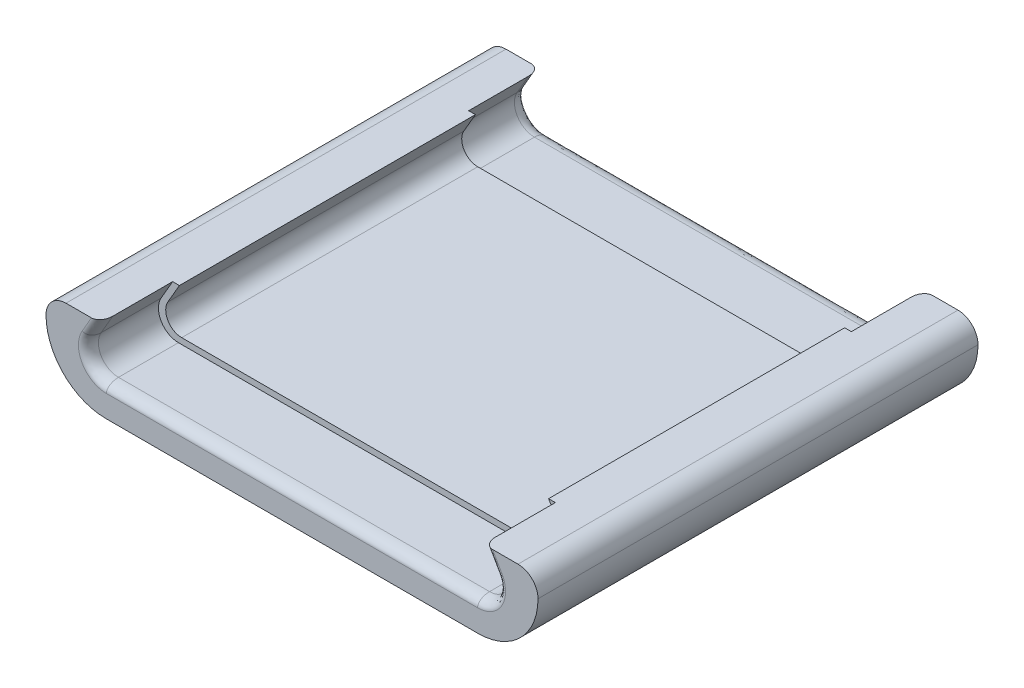
from build123d import *
from build123d.topology import SkipClean

# Parameters (mm, degrees)
SKETCH1_W           = 123
SKETCH1_H           = 110
BOSS_EXTRUDE1_DEPTH = 20
CUT_EXTRUDE3_DEPTH  = 150
FILLET2_R           = 5
FILLET5_R           = 15
FILLET6_SIZE        = 2
FILLET6_SIZE_2      = 3
FILLET7_SIZE        = 2
FILLET7_SIZE_2      = 3
FILLET8_R           = 5
BOSS_EXTRUDE3_START = -18
SKETCH6_W           = 113
SKETCH6_H           = 14.5
BOSS_EXTRUDE3_DEPTH = 64
CUT_EXTRUDE4_DEPTH  = 64
FILLET10_R          = 4
BOSS_EXTRUDE4_DEPTH = 10


# Some blends are built 0.0001 mm under size
with BuildPart() as part:
    # Sketch1 → Boss-Extrude1 (new body)
    with BuildSketch(Plane(origin=(0, 0, 0), x_dir=(1, 0, 0), z_dir=(0, 1, 0))):
        with Locations((53.726554268, 129.299262381)):
            Rectangle(SKETCH1_W, SKETCH1_H)
    extrude(amount=BOSS_EXTRUDE1_DEPTH)

    # Sketch5 → Cut-Extrude3 (cut)
    with BuildSketch(Plane.XY.offset(-74.299262381)):
        Polygon((5.893432633, 20), (101.559675903, 20), (108.776554268, 7.5), (-1.323445732, 7.5), align=None)
    extrude(amount=-CUT_EXTRUDE3_DEPTH, mode=Mode.SUBTRACT)

    # Fillet2
    fillet2_edges = [part.edges().sort_by_distance(p)[0] for p in [
        (108.776554268, 7.5, -129.299262381),
        (-1.323445732, 7.5, -129.299262381),
    ]]
    fillet(fillet2_edges, radius=FILLET2_R)

    # Fillet5
    fillet5_edges = [part.edges().sort_by_distance(p)[0] for p in [
        (115.226554268, 0, -129.299262381),
        (-7.773445732, 0, -129.299262381),
    ]]
    fillet(fillet5_edges, radius=FILLET5_R)

    # Fillet6
    # an asymmetric fillet: 3, 2 mm, written as the material it takes off along each edge
    with BuildSketch(Plane(origin=(3.006681287, 15, -74.299262381), x_dir=(-0.8660254037844386, 0.5000000000000001, 0), z_dir=(0.5000000000000001, 0.8660254037844387, 0)), Plane(origin=(97.809675903, 26.495190529, -74.299262381), x_dir=(0.8660254037844344, 0.5000000000000074, 0), z_dir=(0.5000000000000074, -0.8660254037844345, 0))) as fillet6_piece_1:
        with BuildLine():
            Bezier((FILLET6_SIZE, 0), (0, 0), (0, -FILLET6_SIZE_2), weights=[1, 0.707106781, 1])
            Line((0, -FILLET6_SIZE_2), (0, 0))
            Line((0, 0), (FILLET6_SIZE, 0))
        make_face()
    extrude(amount=13.273502692, mode=Mode.SUBTRACT)
    with BuildSketch(Plane(origin=(7.336808305, 12.5, -74.299262381), x_dir=(0, -1, 0), z_dir=(1, 0, 0))) as fillet6_piece_2:
        with BuildLine():
            Bezier((5 + FILLET6_SIZE, 0), (5, 0), (5, FILLET6_SIZE_2), weights=[1, 0.707106781, 1])
            Line((5, FILLET6_SIZE_2), (5, 0))
            Line((5, 0), (5 + FILLET6_SIZE, 0))
        make_face()
    revolve(axis=Axis((7.336808305, 12.5, -74.299262381), (0, 0, -1)), revolution_arc=120, mode=Mode.SUBTRACT)
    with BuildSketch(Plane(origin=(100.11630023, 12.5, -74.299262381), x_dir=(0.8660254037844343, 0.5000000000000077, 0), z_dir=(-0.5000000000000077, 0.8660254037844343, 0))) as fillet6_piece_3:
        with BuildLine():
            Bezier((5 + FILLET6_SIZE, 0), (5, 0), (5, FILLET6_SIZE_2), weights=[1, 0.707106781, 1])
            Line((5, FILLET6_SIZE_2), (5, 0))
            Line((5, 0), (5 + FILLET6_SIZE, 0))
        make_face()
    revolve(axis=Axis((100.11630023, 12.5, -74.299262381), (0, 0, -1)), revolution_arc=120, mode=Mode.SUBTRACT)
    with BuildSketch(Plane(origin=(100.11630023, 7.5, -74.299262381), x_dir=(0, -1, 0), z_dir=(-1, 0, 0))) as fillet6_piece_4:
        with BuildLine():
            Bezier((FILLET6_SIZE, 0), (0, 0), (0, -FILLET6_SIZE_2), weights=[1, 0.707106781, 1])
            Line((0, -FILLET6_SIZE_2), (0, 0))
            Line((0, 0), (FILLET6_SIZE, 0))
        make_face()
    extrude(amount=92.779491924, mode=Mode.SUBTRACT)

    # Fillet7
    # an asymmetric fillet: 3, 2 mm, written as the material it takes off along each edge
    with BuildSketch(Plane(origin=(3.006681287, 15, -184.299262381), x_dir=(-0.8660254037844386, 0.5000000000000001, 0), z_dir=(0.5000000000000001, 0.8660254037844387, 0)), Plane(origin=(97.809675903, 26.495190528, -184.299262381), x_dir=(0.8660254037844344, 0.5000000000000074, 0), z_dir=(0.5000000000000074, -0.8660254037844345, 0))) as fillet7_piece_1:
        with BuildLine():
            Bezier((FILLET7_SIZE, 0), (0, 0), (0, FILLET7_SIZE_2), weights=[1, 0.707106781, 1])
            Line((0, FILLET7_SIZE_2), (0, 0))
            Line((0, 0), (FILLET7_SIZE, 0))
        make_face()
    extrude(amount=13.273502692, mode=Mode.SUBTRACT)
    with BuildSketch(Plane(origin=(7.336808305, 12.5, -184.299262381), x_dir=(0, -1, 0), z_dir=(1, 0, 0))) as fillet7_piece_2:
        with BuildLine():
            Bezier((5 + FILLET7_SIZE, 0), (5, 0), (5, -FILLET7_SIZE_2), weights=[1, 0.707106781, 1])
            Line((5, -FILLET7_SIZE_2), (5, 0))
            Line((5, 0), (5 + FILLET7_SIZE, 0))
        make_face()
    revolve(axis=Axis((7.336808305, 12.5, -184.299262381), (0, 0, -1)), revolution_arc=120, mode=Mode.SUBTRACT)
    with BuildSketch(Plane(origin=(100.11630023, 12.5, -184.299262381), x_dir=(0.8660254037844343, 0.5000000000000077, 0), z_dir=(-0.5000000000000077, 0.8660254037844343, 0))) as fillet7_piece_3:
        with BuildLine():
            Bezier((5 + FILLET7_SIZE, 0), (5, 0), (5, -FILLET7_SIZE_2), weights=[1, 0.707106781, 1])
            Line((5, -FILLET7_SIZE_2), (5, 0))
            Line((5, 0), (5 + FILLET7_SIZE, 0))
        make_face()
    revolve(axis=Axis((100.11630023, 12.5, -184.299262381), (0, 0, -1)), revolution_arc=120, mode=Mode.SUBTRACT)
    with BuildSketch(Plane(origin=(100.11630023, 7.5, -184.299262381), x_dir=(0, -1, 0), z_dir=(-1, 0, 0))) as fillet7_piece_4:
        with BuildLine():
            Bezier((FILLET7_SIZE, 0), (0, 0), (0, FILLET7_SIZE_2), weights=[1, 0.707106781, 1])
            Line((0, FILLET7_SIZE_2), (0, 0))
            Line((0, 0), (FILLET7_SIZE, 0))
        make_face()
    extrude(amount=92.779491924, mode=Mode.SUBTRACT)

    # Fillet8
    fillet8_edges = [part.edges().sort_by_distance(p)[0] for p in [
        (-7.773445732, 20, -129.299262381),
        (115.226554268, 20, -129.299262381),
    ]]
    fillet(fillet8_edges, radius=FILLET8_R - 0.0001)  # a hair under: the kernel refuses the full size

    # Sketch6 → Boss-Extrude3 (add)
    with BuildSketch(Plane(origin=(0, 0, -184.299262381), x_dir=(-1, 0, 0), z_dir=(0, 0, -1)).offset(BOSS_EXTRUDE3_START)):
        with Locations((-53.726554268, 12.75)):
            Rectangle(SKETCH6_W, SKETCH6_H)
    extrude(amount=-BOSS_EXTRUDE3_DEPTH)

    # Sketch8 → Cut-Extrude4 (cut)
    with BuildSketch(Plane.XY.offset(-102.299262381)):
        Polygon((1.226554268, 9), (106.226554268, 9), (99.875701307, 20), (7.577407229, 20), align=None)
    extrude(amount=-CUT_EXTRUDE4_DEPTH, mode=Mode.SUBTRACT)

    # Fillet10
    # the kernel refuses this fillet: 4 mm, written as the material it adds along each edge
    with BuildSketch(Plane(origin=(1.226554268, 9, -102.299262381), x_dir=(0.5000000000000043, 0.8660254037844362, 0), z_dir=(0, 0, -1))) as fillet10_piece_1:
        with BuildLine():
            CenterArc((FILLET10_R * 1.73205080757, FILLET10_R), FILLET10_R, 150, 120)
            Line((FILLET10_R * 0.866025403784, FILLET10_R * 1.5), (0, 0))
            Line((0, 0), (FILLET10_R * 1.73205080757, 0))
        make_face()
    extrude(amount=64)
    with BuildSketch(Plane(origin=(106.226554268, 9, -102.299262381), x_dir=(-0.5000000000000053, 0.8660254037844355, 0), z_dir=(0, 0, -1))) as fillet10_piece_2:
        with BuildLine():
            CenterArc((FILLET10_R * 1.73205080757, -FILLET10_R), FILLET10_R, 90, 120)
            Line((FILLET10_R * 0.866025403784, -FILLET10_R * 1.5), (0, 0))
            Line((0, 0), (FILLET10_R * 1.73205080757, 0))
        make_face()
    extrude(amount=64)

    # Sketch9 → Boss-Extrude4 (add)
    with SkipClean():  # the faces are left unmerged after this step: merging them gives an invalid solid
        with BuildSketch(Plane.XY.offset(-102.299262381)):
            with BuildLine():
                Line((8.154757498, 9), (99.298351037, 9))
                ThreePointArc((99.298351037, 9), (102.762452653, 11), (102.762452653, 15))
                Line((102.762452653, 15), (99.875701307, 20))
                Line((99.875701307, 20), (101.559675903, 20))
                Line((101.559675903, 20), (104.446427249, 15))
                ThreePointArc((104.446427249, 15), (104.446427249, 10), (100.11630023, 7.5))
                Line((100.11630023, 7.5), (7.336808305, 7.5))
                ThreePointArc((7.336808305, 7.5), (3.014687704, 9.986183479), (2.990801035, 14.972290599))
                ThreePointArc((2.990801035, 14.972290599), (2.998719037, 14.986157979), (3.006681287, 15))
                Line((3.006681287, 15), (5.893432633, 20))
                Line((5.893432633, 20), (7.577407229, 20))
                Line((7.577407229, 20), (4.690655883, 15))
                ThreePointArc((4.690655883, 15), (4.690655883, 11), (8.154757498, 9))
            make_face()
        extrude(amount=BOSS_EXTRUDE4_DEPTH)


solid = part.part
